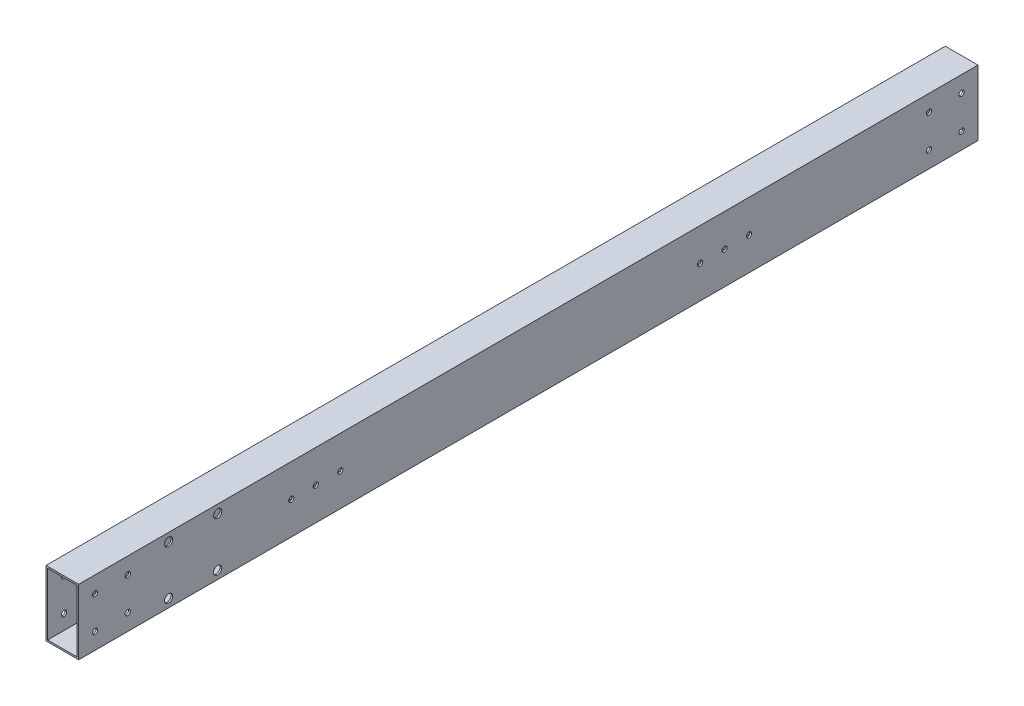
from build123d import *

# Parameters (mm, degrees)
SKETCH_1_W          = 20
SKETCH_1_H          = 40
SKETCH_1_W_2        = 18
SKETCH_1_H_2        = 38
EXTRUDE_1_DEPTH     = 550
SKETCH_2_R          = 1.6
CUT_EXTRUDE_1_DEPTH = 552.815186453
SKETCH_3_R          = 2.5
CUT_EXTRUDE_2_DEPTH = 552.815186453
CUT_EXTRUDE_3_REACH = 553.815
SKETCH_4_R          = 1.75
SKETCH_5_R          = 1.6
CUT_EXTRUDE_4_DEPTH = 552.815186453


with BuildPart() as part:
    # 草图1 → 拉伸-薄壁1 (new body)
    with BuildSketch(Plane.XY):
        with Locations((10, -20)):
            Rectangle(SKETCH_1_W, SKETCH_1_H)
        with Locations((10, -20)):
            Rectangle(SKETCH_1_W_2, SKETCH_1_H_2, mode=Mode.SUBTRACT)
    extrude(amount=EXTRUDE_1_DEPTH)

    # 草图2 → 切除-拉伸1 (cut, through all)
    with BuildSketch(Plane.ZY):
        with Locations((420, -20)):
            Circle(SKETCH_2_R)
        with Locations((405, -20)):
            Circle(SKETCH_2_R)
        with Locations((390, -20)):
            Circle(SKETCH_2_R)
        with Locations((140, -20)):
            Circle(SKETCH_2_R)
        with Locations((155, -20)):
            Circle(SKETCH_2_R)
        with Locations((170, -20)):
            Circle(SKETCH_2_R)
    extrude(amount=-CUT_EXTRUDE_1_DEPTH, mode=Mode.SUBTRACT)

    # 草图3 → 切除-拉伸2 (cut, through all)
    with BuildSketch(Plane.ZY):
        with Locations((495, -35)):
            Circle(SKETCH_3_R)
        with Locations((465, -35)):
            Circle(SKETCH_3_R)
        with Locations((465, -5)):
            Circle(SKETCH_3_R)
        with Locations((495, -5)):
            Circle(SKETCH_3_R)
    extrude(amount=-CUT_EXTRUDE_2_DEPTH, mode=Mode.SUBTRACT)

    # 草图4 → 切除-拉伸3 (cut, up to next)
    with BuildSketch(Plane.XZ.offset(40), mode=Mode.PRIVATE) as cut_extrude_3_sk1:
        with Locations((10, 50)):
            Circle(SKETCH_4_R)
    cut_extrude_3_tool1 = extrude(cut_extrude_3_sk1.sketch, amount=-CUT_EXTRUDE_3_REACH, mode=Mode.PRIVATE) & part.part
    # 草图4 → 切除-拉伸3 (cut, up to next)
    with BuildSketch(Plane.XZ.offset(40), mode=Mode.PRIVATE) as cut_extrude_3_sk2:
        with Locations((10, 70)):
            Circle(SKETCH_4_R)
    cut_extrude_3_tool2 = extrude(cut_extrude_3_sk2.sketch, amount=-CUT_EXTRUDE_3_REACH, mode=Mode.PRIVATE) & part.part
    # 草图4 → 切除-拉伸3 (cut, up to next)
    with BuildSketch(Plane.XZ.offset(40), mode=Mode.PRIVATE) as cut_extrude_3_sk3:
        with Locations((10, 90)):
            Circle(SKETCH_4_R)
    cut_extrude_3_tool3 = extrude(cut_extrude_3_sk3.sketch, amount=-CUT_EXTRUDE_3_REACH, mode=Mode.PRIVATE) & part.part
    # 草图4 → 切除-拉伸3 (cut, up to next)
    with BuildSketch(Plane.XZ.offset(40), mode=Mode.PRIVATE) as cut_extrude_3_sk4:
        with Locations((10, 110)):
            Circle(SKETCH_4_R)
    cut_extrude_3_tool4 = extrude(cut_extrude_3_sk4.sketch, amount=-CUT_EXTRUDE_3_REACH, mode=Mode.PRIVATE) & part.part
    # 草图4 → 切除-拉伸3 (cut, up to next)
    with BuildSketch(Plane.XZ.offset(40), mode=Mode.PRIVATE) as cut_extrude_3_sk5:
        with Locations((10, 130)):
            Circle(SKETCH_4_R)
    cut_extrude_3_tool5 = extrude(cut_extrude_3_sk5.sketch, amount=-CUT_EXTRUDE_3_REACH, mode=Mode.PRIVATE) & part.part
    # 草图4 → 切除-拉伸3 (cut, up to next)
    with BuildSketch(Plane.XZ.offset(40), mode=Mode.PRIVATE) as cut_extrude_3_sk6:
        with Locations((10, 150)):
            Circle(SKETCH_4_R)
    cut_extrude_3_tool6 = extrude(cut_extrude_3_sk6.sketch, amount=-CUT_EXTRUDE_3_REACH, mode=Mode.PRIVATE) & part.part
    # 草图4 → 切除-拉伸3 (cut, up to next)
    with BuildSketch(Plane.XZ.offset(40), mode=Mode.PRIVATE) as cut_extrude_3_sk7:
        with Locations((10, 170)):
            Circle(SKETCH_4_R)
    cut_extrude_3_tool7 = extrude(cut_extrude_3_sk7.sketch, amount=-CUT_EXTRUDE_3_REACH, mode=Mode.PRIVATE) & part.part
    # 草图4 → 切除-拉伸3 (cut, up to next)
    with BuildSketch(Plane.XZ.offset(40), mode=Mode.PRIVATE) as cut_extrude_3_sk8:
        with Locations((10, 190)):
            Circle(SKETCH_4_R)
    cut_extrude_3_tool8 = extrude(cut_extrude_3_sk8.sketch, amount=-CUT_EXTRUDE_3_REACH, mode=Mode.PRIVATE) & part.part
    # 草图4 → 切除-拉伸3 (cut, up to next)
    with BuildSketch(Plane.XZ.offset(40), mode=Mode.PRIVATE) as cut_extrude_3_sk9:
        with Locations((10, 210)):
            Circle(SKETCH_4_R)
    cut_extrude_3_tool9 = extrude(cut_extrude_3_sk9.sketch, amount=-CUT_EXTRUDE_3_REACH, mode=Mode.PRIVATE) & part.part
    # 草图4 → 切除-拉伸3 (cut, up to next)
    with BuildSketch(Plane.XZ.offset(40), mode=Mode.PRIVATE) as cut_extrude_3_sk10:
        with Locations((10, 230)):
            Circle(SKETCH_4_R)
    cut_extrude_3_tool10 = extrude(cut_extrude_3_sk10.sketch, amount=-CUT_EXTRUDE_3_REACH, mode=Mode.PRIVATE) & part.part
    # 草图4 → 切除-拉伸3 (cut, up to next)
    with BuildSketch(Plane.XZ.offset(40), mode=Mode.PRIVATE) as cut_extrude_3_sk11:
        with Locations((10, 250)):
            Circle(SKETCH_4_R)
    cut_extrude_3_tool11 = extrude(cut_extrude_3_sk11.sketch, amount=-CUT_EXTRUDE_3_REACH, mode=Mode.PRIVATE) & part.part
    # 草图4 → 切除-拉伸3 (cut, up to next)
    with BuildSketch(Plane.XZ.offset(40), mode=Mode.PRIVATE) as cut_extrude_3_sk12:
        with Locations((10, 270)):
            Circle(SKETCH_4_R)
    cut_extrude_3_tool12 = extrude(cut_extrude_3_sk12.sketch, amount=-CUT_EXTRUDE_3_REACH, mode=Mode.PRIVATE) & part.part
    # 草图4 → 切除-拉伸3 (cut, up to next)
    with BuildSketch(Plane.XZ.offset(40), mode=Mode.PRIVATE) as cut_extrude_3_sk13:
        with Locations((10, 290)):
            Circle(SKETCH_4_R)
    cut_extrude_3_tool13 = extrude(cut_extrude_3_sk13.sketch, amount=-CUT_EXTRUDE_3_REACH, mode=Mode.PRIVATE) & part.part
    # 草图4 → 切除-拉伸3 (cut, up to next)
    with BuildSketch(Plane.XZ.offset(40), mode=Mode.PRIVATE) as cut_extrude_3_sk14:
        with Locations((10, 310)):
            Circle(SKETCH_4_R)
    cut_extrude_3_tool14 = extrude(cut_extrude_3_sk14.sketch, amount=-CUT_EXTRUDE_3_REACH, mode=Mode.PRIVATE) & part.part
    # 草图4 → 切除-拉伸3 (cut, up to next)
    with BuildSketch(Plane.XZ.offset(40), mode=Mode.PRIVATE) as cut_extrude_3_sk15:
        with Locations((10, 330)):
            Circle(SKETCH_4_R)
    cut_extrude_3_tool15 = extrude(cut_extrude_3_sk15.sketch, amount=-CUT_EXTRUDE_3_REACH, mode=Mode.PRIVATE) & part.part
    # 草图4 → 切除-拉伸3 (cut, up to next)
    with BuildSketch(Plane.XZ.offset(40), mode=Mode.PRIVATE) as cut_extrude_3_sk16:
        with Locations((10, 350)):
            Circle(SKETCH_4_R)
    cut_extrude_3_tool16 = extrude(cut_extrude_3_sk16.sketch, amount=-CUT_EXTRUDE_3_REACH, mode=Mode.PRIVATE) & part.part
    # 草图4 → 切除-拉伸3 (cut, up to next)
    with BuildSketch(Plane.XZ.offset(40), mode=Mode.PRIVATE) as cut_extrude_3_sk17:
        with Locations((10, 370)):
            Circle(SKETCH_4_R)
    cut_extrude_3_tool17 = extrude(cut_extrude_3_sk17.sketch, amount=-CUT_EXTRUDE_3_REACH, mode=Mode.PRIVATE) & part.part
    # 草图4 → 切除-拉伸3 (cut, up to next)
    with BuildSketch(Plane.XZ.offset(40), mode=Mode.PRIVATE) as cut_extrude_3_sk18:
        with Locations((10, 390)):
            Circle(SKETCH_4_R)
    cut_extrude_3_tool18 = extrude(cut_extrude_3_sk18.sketch, amount=-CUT_EXTRUDE_3_REACH, mode=Mode.PRIVATE) & part.part
    # 草图4 → 切除-拉伸3 (cut, up to next)
    with BuildSketch(Plane.XZ.offset(40), mode=Mode.PRIVATE) as cut_extrude_3_sk19:
        with Locations((10, 410)):
            Circle(SKETCH_4_R)
    cut_extrude_3_tool19 = extrude(cut_extrude_3_sk19.sketch, amount=-CUT_EXTRUDE_3_REACH, mode=Mode.PRIVATE) & part.part
    # 草图4 → 切除-拉伸3 (cut, up to next)
    with BuildSketch(Plane.XZ.offset(40), mode=Mode.PRIVATE) as cut_extrude_3_sk20:
        with Locations((10, 430)):
            Circle(SKETCH_4_R)
    cut_extrude_3_tool20 = extrude(cut_extrude_3_sk20.sketch, amount=-CUT_EXTRUDE_3_REACH, mode=Mode.PRIVATE) & part.part
    # 草图4 → 切除-拉伸3 (cut, up to next)
    with BuildSketch(Plane.XZ.offset(40), mode=Mode.PRIVATE) as cut_extrude_3_sk21:
        with Locations((10, 450)):
            Circle(SKETCH_4_R)
    cut_extrude_3_tool21 = extrude(cut_extrude_3_sk21.sketch, amount=-CUT_EXTRUDE_3_REACH, mode=Mode.PRIVATE) & part.part
    # 草图4 → 切除-拉伸3 (cut, up to next)
    with BuildSketch(Plane.XZ.offset(40), mode=Mode.PRIVATE) as cut_extrude_3_sk22:
        with Locations((10, 470)):
            Circle(SKETCH_4_R)
    cut_extrude_3_tool22 = extrude(cut_extrude_3_sk22.sketch, amount=-CUT_EXTRUDE_3_REACH, mode=Mode.PRIVATE) & part.part
    # 草图4 → 切除-拉伸3 (cut, up to next)
    with BuildSketch(Plane.XZ.offset(40), mode=Mode.PRIVATE) as cut_extrude_3_sk23:
        with Locations((10, 490)):
            Circle(SKETCH_4_R)
    cut_extrude_3_tool23 = extrude(cut_extrude_3_sk23.sketch, amount=-CUT_EXTRUDE_3_REACH, mode=Mode.PRIVATE) & part.part
    add(cut_extrude_3_tool1.solids().sort_by_distance((10, -40, 50))[0], mode=Mode.SUBTRACT)
    add(cut_extrude_3_tool2.solids().sort_by_distance((10, -40, 70))[0], mode=Mode.SUBTRACT)
    add(cut_extrude_3_tool3.solids().sort_by_distance((10, -40, 90))[0], mode=Mode.SUBTRACT)
    add(cut_extrude_3_tool4.solids().sort_by_distance((10, -40, 110))[0], mode=Mode.SUBTRACT)
    add(cut_extrude_3_tool5.solids().sort_by_distance((10, -40, 130))[0], mode=Mode.SUBTRACT)
    add(cut_extrude_3_tool6.solids().sort_by_distance((10, -40, 150))[0], mode=Mode.SUBTRACT)
    add(cut_extrude_3_tool7.solids().sort_by_distance((10, -40, 170))[0], mode=Mode.SUBTRACT)
    add(cut_extrude_3_tool8.solids().sort_by_distance((10, -40, 190))[0], mode=Mode.SUBTRACT)
    add(cut_extrude_3_tool9.solids().sort_by_distance((10, -40, 210))[0], mode=Mode.SUBTRACT)
    add(cut_extrude_3_tool10.solids().sort_by_distance((10, -40, 230))[0], mode=Mode.SUBTRACT)
    add(cut_extrude_3_tool11.solids().sort_by_distance((10, -40, 250))[0], mode=Mode.SUBTRACT)
    add(cut_extrude_3_tool12.solids().sort_by_distance((10, -40, 270))[0], mode=Mode.SUBTRACT)
    add(cut_extrude_3_tool13.solids().sort_by_distance((10, -40, 290))[0], mode=Mode.SUBTRACT)
    add(cut_extrude_3_tool14.solids().sort_by_distance((10, -40, 310))[0], mode=Mode.SUBTRACT)
    add(cut_extrude_3_tool15.solids().sort_by_distance((10, -40, 330))[0], mode=Mode.SUBTRACT)
    add(cut_extrude_3_tool16.solids().sort_by_distance((10, -40, 350))[0], mode=Mode.SUBTRACT)
    add(cut_extrude_3_tool17.solids().sort_by_distance((10, -40, 370))[0], mode=Mode.SUBTRACT)
    add(cut_extrude_3_tool18.solids().sort_by_distance((10, -40, 390))[0], mode=Mode.SUBTRACT)
    add(cut_extrude_3_tool19.solids().sort_by_distance((10, -40, 410))[0], mode=Mode.SUBTRACT)
    add(cut_extrude_3_tool20.solids().sort_by_distance((10, -40, 430))[0], mode=Mode.SUBTRACT)
    add(cut_extrude_3_tool21.solids().sort_by_distance((10, -40, 450))[0], mode=Mode.SUBTRACT)
    add(cut_extrude_3_tool22.solids().sort_by_distance((10, -40, 470))[0], mode=Mode.SUBTRACT)
    add(cut_extrude_3_tool23.solids().sort_by_distance((10, -40, 490))[0], mode=Mode.SUBTRACT)

    # 草图5 → 切除-拉伸4 (cut, through all)
    with BuildSketch(Plane.ZY):
        with Locations((540, -10)):
            Circle(SKETCH_5_R)
        with Locations((540, -30)):
            Circle(SKETCH_5_R)
        with Locations((520, -30)):
            Circle(SKETCH_5_R)
        with Locations((520, -10)):
            Circle(SKETCH_5_R)
        with Locations((10, -10)):
            Circle(SKETCH_5_R)
        with Locations((30, -10)):
            Circle(SKETCH_5_R)
        with Locations((10, -30)):
            Circle(SKETCH_5_R)
        with Locations((30, -30)):
            Circle(SKETCH_5_R)
    extrude(amount=-CUT_EXTRUDE_4_DEPTH, mode=Mode.SUBTRACT)


solid = part.part
